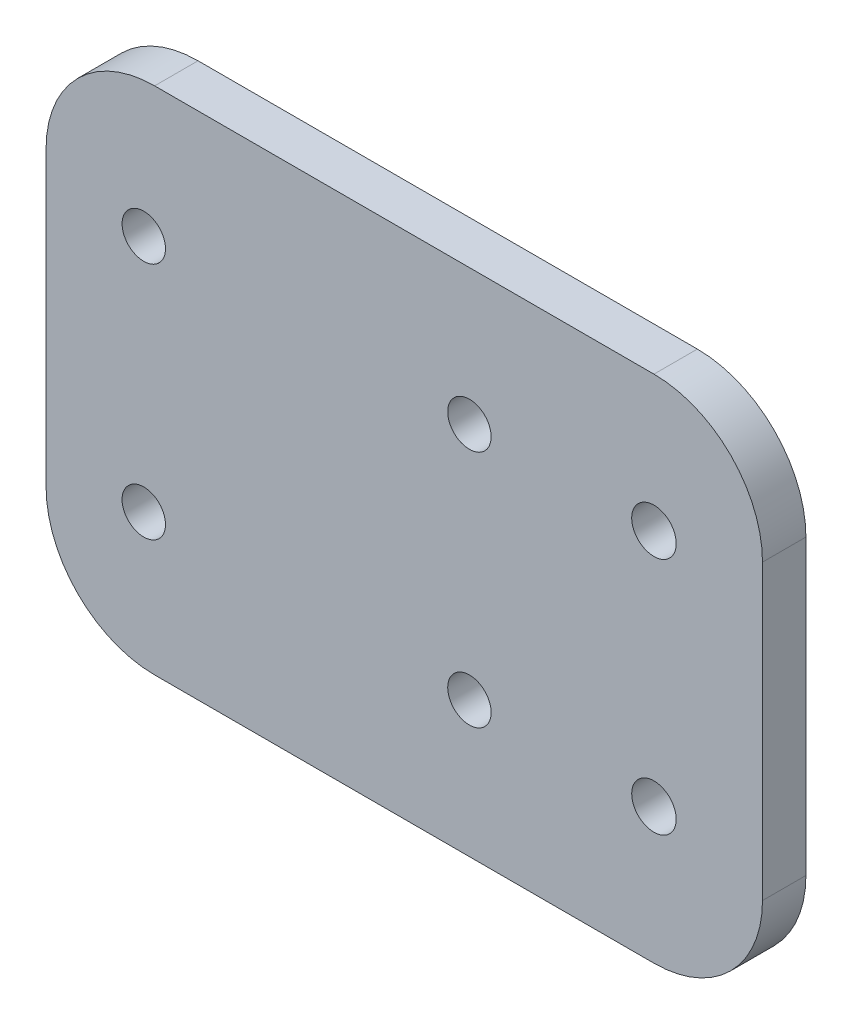
from build123d import *

# Parameters (mm, degrees)
SKETCH_1_W          = 66
SKETCH_1_H          = 47
EXTRUDE_1_DEPTH     = 4
FILLET_1_R          = 10
SKETCH_2_R          = 2
SKETCH_2_R_2        = 2.05
CUT_EXTRUDE_1_DEPTH = 4


with BuildPart() as part:
    # 草图1 → 凸台-拉伸1 (new body)
    with BuildSketch(Plane.XY):
        with Locations((33, 23.5)):
            Rectangle(SKETCH_1_W, SKETCH_1_H)
    extrude(amount=EXTRUDE_1_DEPTH)

    # 圆角1
    fillet_1_edges = [part.edges().sort_by_distance(p)[0] for p in [
        (0, 47, 2),
        (66, 0, 2),
        (0, 0, 2),
        (66, 47, 2),
    ]]
    fillet(fillet_1_edges, radius=FILLET_1_R)

    # 草图2 → 切除-拉伸1 (cut)
    with BuildSketch(Plane.XY.offset(4)):
        with Locations((9, 34.5)):
            Circle(SKETCH_2_R)
        with Locations((9, 12.5)):
            Circle(SKETCH_2_R)
        with Locations((39, 34.5)):
            Circle(SKETCH_2_R)
        with Locations((39, 12.5)):
            Circle(SKETCH_2_R)
        with Locations((56, 34.5)):
            Circle(SKETCH_2_R_2)
        with Locations((56, 12.5)):
            Circle(SKETCH_2_R_2)
    extrude(amount=-CUT_EXTRUDE_1_DEPTH, mode=Mode.SUBTRACT)


solid = part.part
